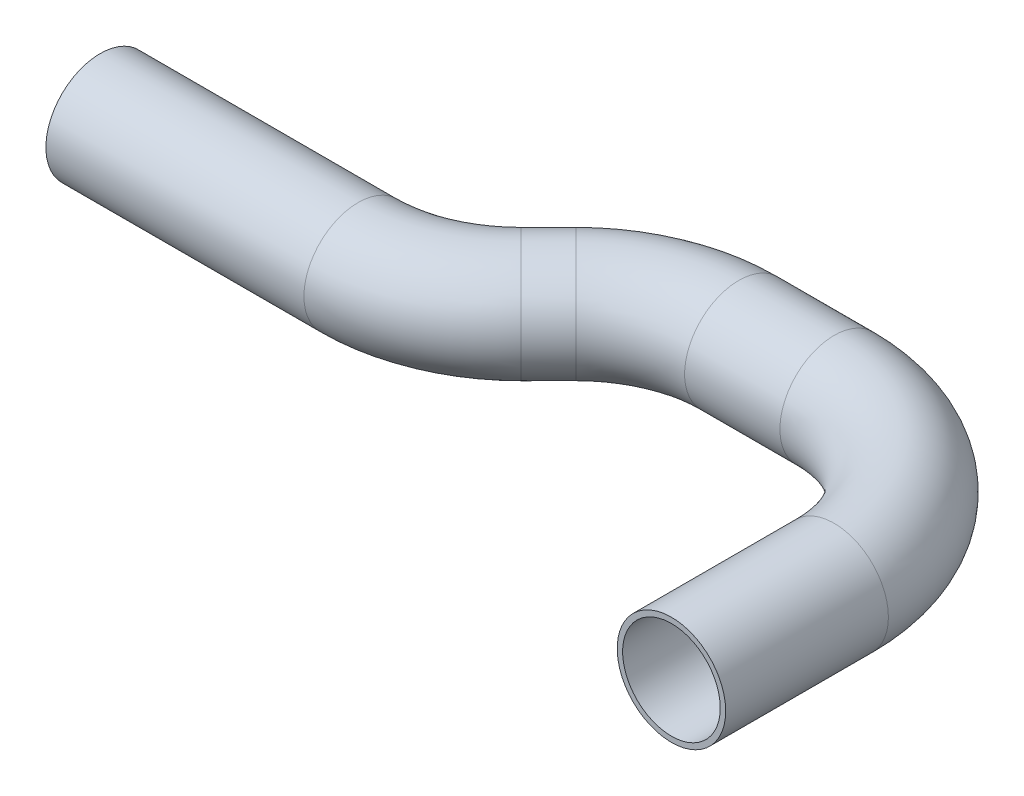
from build123d import *

# Parameters (mm, degrees)
SKETCH2_R   = 6.35
SKETCH2_R_2 = 5.715


with BuildPart() as part:
    # Sweep1: sweep along a path in Sketch1
    with BuildLine(Plane(origin=(0, 0, 0), x_dir=(1, 0, 0), z_dir=(0, 1, 0))) as sweep1_path:
        Line((0, 0), (30.209231637, 0))
        ThreePointArc((30.209231637, 0), (37.499351023, 1.450094906), (43.679615818, 5.579615818))
        Line((43.679615818, 5.579615818), (46.914242973, 8.814242973))
        ThreePointArc((46.914242973, 8.814242973), (53.094507768, 12.943763886), (60.384627155, 14.393858792))
        Line((60.384627155, 14.393858792), (71.543858792, 14.393858792))
        ThreePointArc((71.543858792, 14.393858792), (85.014242973, 8.814242973), (90.593858792, -4.656141208))
        Line((90.593858792, -4.656141208), (90.593858792, -23.706141208))
    # Sketch2 → Sweep1 (sweep)
    with BuildSketch(Plane(origin=(0, 0, 0), x_dir=(0, 0, -1), z_dir=(1, 0, 0))):
        Circle(SKETCH2_R)
        Circle(SKETCH2_R_2, mode=Mode.SUBTRACT)
    sweep(path=sweep1_path.line)


solid = part.part
